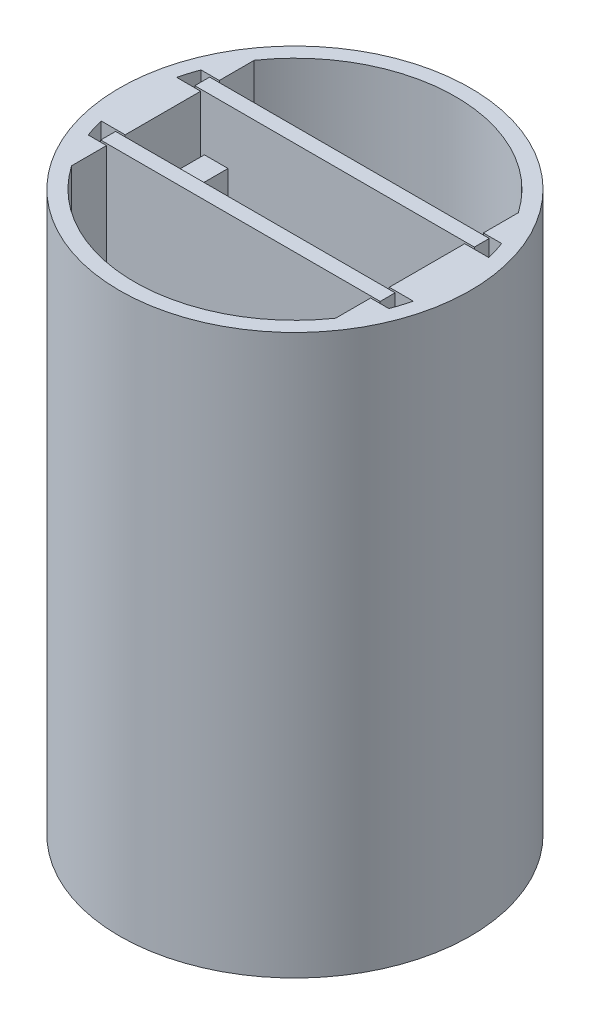
from build123d import *

# Parameters (mm, degrees)
OBC_2_W             = 30
OBC_2_H             = 55
OBC_DEPTH           = 1.6
HEADERS_START       = 5.91
HEADERS_OUTLINE_W   = 2.54
HEADERS_OUTLINE_H   = 8.5
HEADERS_DEPTH       = 43.18
RF_START            = -10.1
RF_2_W              = 30
RF_2_H              = 60
RF_DEPTH            = 1.6
BOSS_EXTRUDE4_START = -5
ENCLOSURE_R         = 18.828638124
ENCLOSURE_R_2       = 17.228638124
BOSS_EXTRUDE4_DEPTH = 60


# Read off the part's stored shape, not the designer's step: Headers
with BuildPart() as part:
    # OBC 2 → OBC (new body)
    with BuildSketch(Plane.XY):
        with Locations((15, 27.5)):
            Rectangle(OBC_2_W, OBC_2_H)
    extrude(amount=-OBC_DEPTH)

    # Headers outline → Headers (add)
    with BuildSketch(Plane(origin=(0, 0, 0), x_dir=(1, 0, 0), z_dir=(0, 1, 0)).offset(HEADERS_START)):
        with Locations((27.7, 5.85)):
            Rectangle(HEADERS_OUTLINE_W, HEADERS_OUTLINE_H)
        with Locations((2.3, 5.85)):
            Rectangle(HEADERS_OUTLINE_W, HEADERS_OUTLINE_H)
    extrude(amount=HEADERS_DEPTH)

    # RF 2 → RF (add)
    with BuildSketch(Plane.XY.offset(RF_START)):
        with Locations((15, 25)):
            Rectangle(RF_2_W, RF_2_H)
    extrude(amount=-RF_DEPTH)


with BuildPart() as body_2:
    # Enclosure → Boss-Extrude4 (new body)
    # profile 1 of 7: a face of its own
    with BuildSketch(Plane(origin=(0, 0, 0), x_dir=(1, 0, 0), z_dir=(0, 1, 0)).offset(BOSS_EXTRUDE4_START)):
        with Locations(Location((15, 5.85, 0), (0, 0, 270))):
            Circle(ENCLOSURE_R)
        with Locations((15, 5.85)):
            Circle(ENCLOSURE_R_2, mode=Mode.SUBTRACT)
    # profile 2 of 7: a face of its own
    with BuildSketch(Plane(origin=(0, 0, 0), x_dir=(1, 0, 0), z_dir=(0, 1, 0)).offset(BOSS_EXTRUDE4_START)):
        with BuildLine():
            ThreePointArc((0.83, 15.649850591), (-0.266293442, 13.835377647), (-1.131443569, 11.9))
            Line((-1.131443569, 11.9), (0.83, 11.9))
            Line((0.83, 11.9), (0.83, 15.649850591))
        make_face()
    # profile 3 of 7: a face of its own
    with BuildSketch(Plane(origin=(0, 0, 0), x_dir=(1, 0, 0), z_dir=(0, 1, 0)).offset(BOSS_EXTRUDE4_START)):
        with BuildLine():
            Line((0.83, 9.9), (-1.745849385, 9.9))
            ThreePointArc((-1.745849385, 9.9), (-2.228638124, 5.85), (-1.745849385, 1.8))
            Line((-1.745849385, 1.8), (0.83, 1.8))
            Line((0.83, 1.8), (0.83, 9.9))
        make_face()
    # profile 4 of 7: a face of its own
    with BuildSketch(Plane(origin=(0, 0, 0), x_dir=(1, 0, 0), z_dir=(0, 1, 0)).offset(BOSS_EXTRUDE4_START)):
        with BuildLine():
            Line((0.83, -0.2), (-1.131443569, -0.2))
            ThreePointArc((-1.131443569, -0.2), (-0.266293442, -2.135377647), (0.83, -3.949850591))
            Line((0.83, -3.949850591), (0.83, -0.2))
        make_face()
    # profile 5 of 7: a face of its own
    with BuildSketch(Plane(origin=(0, 0, 0), x_dir=(1, 0, 0), z_dir=(0, 1, 0)).offset(BOSS_EXTRUDE4_START)):
        with BuildLine():
            Line((29.17, -0.2), (29.17, -3.949850591))
            ThreePointArc((29.17, -3.949850591), (30.266293442, -2.135377647), (31.131443569, -0.2))
            Line((31.131443569, -0.2), (29.17, -0.2))
        make_face()
    # profile 6 of 7: a face of its own
    with BuildSketch(Plane(origin=(0, 0, 0), x_dir=(1, 0, 0), z_dir=(0, 1, 0)).offset(BOSS_EXTRUDE4_START)):
        with BuildLine():
            ThreePointArc((32.228638124, 5.85), (32.107515172, 7.889337206), (31.745849385, 9.9))
            Line((31.745849385, 9.9), (29.17, 9.9))
            Line((29.17, 9.9), (29.17, 1.8))
            Line((29.17, 1.8), (31.745849385, 1.8))
            ThreePointArc((31.745849385, 1.8), (32.107515172, 3.810662794), (32.228638124, 5.85))
        make_face()
    # profile 7 of 7: a face of its own
    with BuildSketch(Plane(origin=(0, 0, 0), x_dir=(1, 0, 0), z_dir=(0, 1, 0)).offset(BOSS_EXTRUDE4_START)):
        with BuildLine():
            ThreePointArc((31.131443569, 11.9), (30.266293442, 13.835377647), (29.17, 15.649850591))
            Line((29.17, 15.649850591), (29.17, 11.9))
            Line((29.17, 11.9), (31.131443569, 11.9))
        make_face()
    extrude(amount=BOSS_EXTRUDE4_DEPTH)


solid = Compound([part.part, body_2.part])
